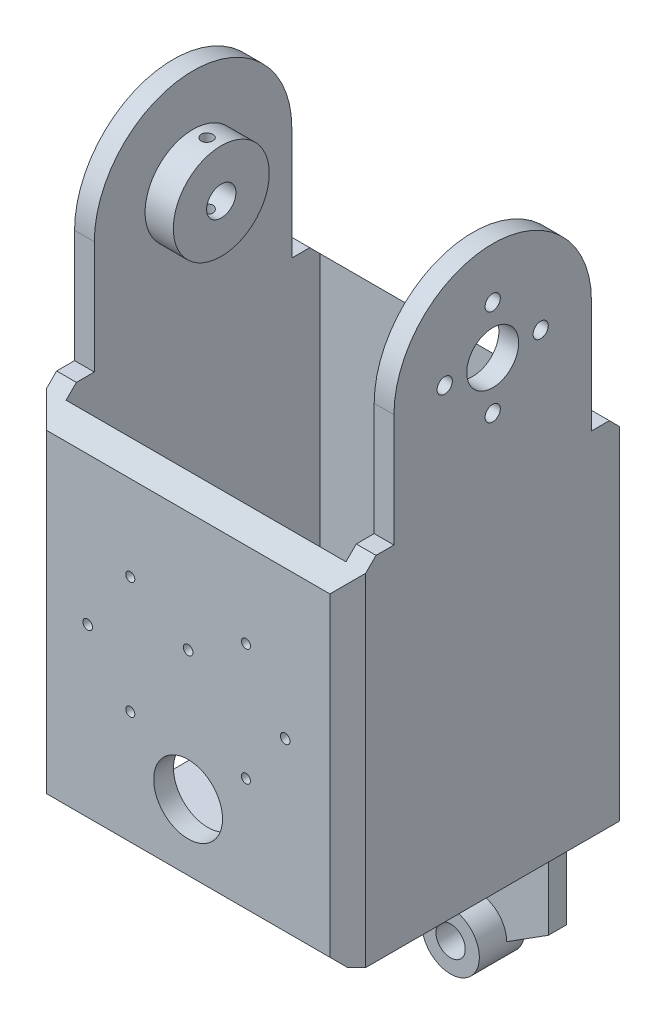
from build123d import *

# Parameters (mm, degrees)
SKETCH1_R                = 4.6
BOSS_EXTRUDE1_DEPTH      = 3.5
BOSS_EXTRUDE2_DEPTH      = 49.6
BOSS_EXTRUDE2_DEPTH_BACK = 3.5
CHAMFER2_SIZE            = 5
CUT_EXTRUDE1_REACH       = 110.911
SKETCH4_W                = 49.6
SKETCH4_H                = 45
BOSS_EXTRUDE3_START      = 3.5
SKETCH5_R                = 4.6
BOSS_EXTRUDE3_DEPTH      = 3.5
CHAMFER3_SIZE            = 3.175
SKETCH6_R                = 8.5
SKETCH6_R_2              = 2.6
BOSS_EXTRUDE4_DEPTH      = 5
SKETCH7_R                = 1.025
CUT_EXTRUDE2_DEPTH       = 114.246948082
CUT_EXTRUDE3_REACH       = 102.655
SKETCH9_R                = 1.35
SKETCH10_W               = 32
SKETCH10_H               = 36.825
SKETCH10_H_2             = 3.175
BOSS_EXTRUDE5_DEPTH      = 3.175
CHAMFER4_SIZE            = 1.5785
BOSS_EXTRUDE6_DEPTH      = 3.175
CHAMFER5_SIZE            = 1.5785
CUT_EXTRUDE4_REACH       = 112.625
SKETCH12_R               = 6.1
SKETCH12_R_2             = 0.800000003
SKETCH12_R_3             = 0.800000004
SKETCH12_R_4             = 0.8
SKETCH13_W               = 4.5
SKETCH13_H               = 25.745434895
SKETCH13_R               = 0.8
SKETCH13_R_2             = 0.800000003
SKETCH13_R_3             = 0.800000004
BOSS_EXTRUDE7_DEPTH      = 2.9
SKETCH14_W               = 15.732338892
SKETCH14_H               = 18.41
SKETCH14_R               = 6.1
BOSS_EXTRUDE8_DEPTH      = 0.325
SKETCH20_R               = 2.6
BOSS_EXTRUDE11_DEPTH     = 3.175
BOSS_EXTRUDE12_START     = 4.84
SKETCH21_R               = 5.1
SKETCH21_R_2             = 2.6
BOSS_EXTRUDE12_DEPTH     = 4.84
CHAMFER10_SIZE           = 3.175
CUT_EXTRUDE5_REACH       = 143.394
SKETCH23_R               = 0.85


with BuildPart() as part:
    # Sketch1 → Boss-Extrude1 (new body)
    with BuildSketch(Plane(origin=(0, 0, 0), x_dir=(0, 0, -1), z_dir=(1, 0, 0))):
        with BuildLine():
            Line((-17.5, 0), (-17.5, -20))
            Line((-17.5, -20), (-22.5, -20))
            Line((-22.5, -20), (-22.5, -76))
            Line((-22.5, -76), (22.5, -76))
            Line((22.5, -76), (22.5, -20))
            Line((22.5, -20), (17.5, -20))
            Line((17.5, -20), (17.5, 0))
            ThreePointArc((17.5, 0), (0, 17.5), (-17.5, 0))
        make_face()
        Circle(SKETCH1_R, mode=Mode.SUBTRACT)
    extrude(amount=-BOSS_EXTRUDE1_DEPTH)

    # Sketch2 → Boss-Extrude2 (add, two sides: drawn at the far end of the back side and taken through both)
    with BuildSketch(Plane(origin=(0, 0, 0), x_dir=(0, 0, -1), z_dir=(1, 0, 0)).offset(-BOSS_EXTRUDE2_DEPTH_BACK)):
        Polygon((-22.5, -20), (-22.5, -76), (22.5, -76), (22.5, -20), (25.675, -20), (25.675, -79.175), (-25.675, -79.175), (-25.675, -20), align=None)
    extrude(amount=BOSS_EXTRUDE2_DEPTH + BOSS_EXTRUDE2_DEPTH_BACK)

    # Chamfer2
    chamfer2_edges = [part.edges().sort_by_distance(p)[0] for p in [
        (23.05, -20, -25.675),
        (23.05, -20, 25.675),
    ]]
    chamfer(chamfer2_edges, length=CHAMFER2_SIZE)

    # Sketch4 → Cut-Extrude1 (cut, up to next)
    with BuildSketch(Plane(origin=(0, -76, 0), x_dir=(1, 0, 0), z_dir=(0, 1, 0)), mode=Mode.PRIVATE) as cut_extrude1_sk1:
        with Locations((24.8, 0)):
            Rectangle(SKETCH4_W, SKETCH4_H)
    cut_extrude1_tool1 = extrude(cut_extrude1_sk1.sketch, amount=-CUT_EXTRUDE1_REACH, mode=Mode.PRIVATE) & part.part
    add(cut_extrude1_tool1.solids().sort_by_distance((24.8, -76, 0))[0], mode=Mode.SUBTRACT)

    # Sketch5 → Boss-Extrude3 (add)
    with BuildSketch(Plane(origin=(49.6, 0, 0), x_dir=(0, 0, -1), z_dir=(1, 0, 0)).offset(BOSS_EXTRUDE3_START)):
        with BuildLine():
            Line((20.675, -20), (17.5, -20))
            Line((17.5, -20), (17.5, 0))
            ThreePointArc((17.5, 0), (0, 17.5), (-17.5, 0))
            Line((-17.5, 0), (-17.5, -20))
            Line((-17.5, -20), (-20.675, -20))
            Line((-20.675, -20), (-25.675, -25))
            Line((-25.675, -25), (-25.675, -79.175))
            Line((-25.675, -79.175), (25.675, -79.175))
            Line((25.675, -79.175), (25.675, -25))
            Line((25.675, -25), (20.675, -20))
        make_face()
        Circle(SKETCH5_R, mode=Mode.SUBTRACT)
    extrude(amount=-BOSS_EXTRUDE3_DEPTH)

    # Chamfer3
    chamfer3_edges = [part.edges().sort_by_distance(p)[0] for p in [
        (-3.5, -52.0875, -25.675),
        (-3.5, -52.0875, 25.675),
        (53.1, -52.0875, 25.675),
        (53.1, -52.0875, -25.675),
    ]]
    chamfer(chamfer3_edges, length=CHAMFER3_SIZE)

    # Sketch6 → Boss-Extrude4 (add)
    with BuildSketch(Plane(origin=(0, 0, 0), x_dir=(0, 0, -1), z_dir=(1, 0, 0))):
        Circle(SKETCH6_R)
        Circle(SKETCH6_R_2, mode=Mode.SUBTRACT)
    extrude(amount=BOSS_EXTRUDE4_DEPTH)

    # Sketch7 → Cut-Extrude2 (cut, through all)
    with BuildSketch(Plane.XZ.offset(79.175)):
        with Locations(Location((2.5, 0, 0), (0, 0, 270))):
            Circle(SKETCH7_R)
    extrude(amount=-CUT_EXTRUDE2_DEPTH, mode=Mode.SUBTRACT)

    # Sketch9 → Cut-Extrude3 (cut, up to next)
    with BuildSketch(Plane(origin=(53.1, 0, 0), x_dir=(0, 0, -1), z_dir=(1, 0, 0)), mode=Mode.PRIVATE) as cut_extrude3_sk1:
        with Locations((0, 8.5)):
            Circle(SKETCH9_R)
    cut_extrude3_tool1 = extrude(cut_extrude3_sk1.sketch, amount=-CUT_EXTRUDE3_REACH, mode=Mode.PRIVATE) & part.part
    # Sketch9 → Cut-Extrude3 (cut, up to next)
    with BuildSketch(Plane(origin=(53.1, 0, 0), x_dir=(0, 0, -1), z_dir=(1, 0, 0)), mode=Mode.PRIVATE) as cut_extrude3_sk2:
        with Locations((8.5, 0)):
            Circle(SKETCH9_R)
    cut_extrude3_tool2 = extrude(cut_extrude3_sk2.sketch, amount=-CUT_EXTRUDE3_REACH, mode=Mode.PRIVATE) & part.part
    # Sketch9 → Cut-Extrude3 (cut, up to next)
    with BuildSketch(Plane(origin=(53.1, 0, 0), x_dir=(0, 0, -1), z_dir=(1, 0, 0)), mode=Mode.PRIVATE) as cut_extrude3_sk3:
        with Locations((0, -8.5)):
            Circle(SKETCH9_R)
    cut_extrude3_tool3 = extrude(cut_extrude3_sk3.sketch, amount=-CUT_EXTRUDE3_REACH, mode=Mode.PRIVATE) & part.part
    # Sketch9 → Cut-Extrude3 (cut, up to next)
    with BuildSketch(Plane(origin=(53.1, 0, 0), x_dir=(0, 0, -1), z_dir=(1, 0, 0)), mode=Mode.PRIVATE) as cut_extrude3_sk4:
        with Locations((-8.5, 0)):
            Circle(SKETCH9_R)
    cut_extrude3_tool4 = extrude(cut_extrude3_sk4.sketch, amount=-CUT_EXTRUDE3_REACH, mode=Mode.PRIVATE) & part.part
    add(cut_extrude3_tool1.solids().sort_by_distance((53.1, 8.5, 0))[0], mode=Mode.SUBTRACT)
    add(cut_extrude3_tool2.solids().sort_by_distance((53.1, 0, -8.5))[0], mode=Mode.SUBTRACT)
    add(cut_extrude3_tool3.solids().sort_by_distance((53.1, -8.5, 0))[0], mode=Mode.SUBTRACT)
    add(cut_extrude3_tool4.solids().sort_by_distance((53.1, 0, 8.5))[0], mode=Mode.SUBTRACT)

    # Sketch10 → Boss-Extrude5 (add)
    with BuildSketch(Plane.XZ.offset(79.175)):
        with Locations((24.8, 4.0875)):
            Rectangle(SKETCH10_W, SKETCH10_H)
        with Locations((24.8, 24.0875)):
            Rectangle(SKETCH10_W, SKETCH10_H_2)
    extrude(amount=BOSS_EXTRUDE5_DEPTH)

    # Chamfer4
    chamfer4_edges = [part.edges().sort_by_distance(p)[0] for p in [
        (24.8, -82.35, 25.675),
    ]]
    chamfer(chamfer4_edges, length=CHAMFER4_SIZE)

    # Sketch11 → Boss-Extrude6 (add)
    with BuildSketch(Plane.XZ.offset(79.175)):
        Polygon((49.925, 25.675), (40.8, 25.675), (40.8, 22.5), (49.6, 22.5), (49.6, -22.5), (0, -22.5), (0, 22.5), (8.8, 22.5), (8.8, 25.675), (-0.325, 25.675), (-3.5, 22.5), (-3.5, -22.5), (-0.325, -25.675), (49.925, -25.675), (53.1, -22.5), (53.1, 22.5), align=None)
    extrude(amount=BOSS_EXTRUDE6_DEPTH)

    # Chamfer5
    chamfer5_edges = [part.edges().sort_by_distance(p)[0] for p in [
        (4.2375, -82.35, 25.675),
        (45.3625, -82.35, 25.675),
    ]]
    chamfer(chamfer5_edges, length=CHAMFER5_SIZE - 0.0001)  # a hair under: the kernel refuses the full size

    # Sketch12 → Cut-Extrude4 (cut, up to next)
    with BuildSketch(Plane.XY.offset(25.675), mode=Mode.PRIVATE) as cut_extrude4_sk1:
        with Locations((24.8, -69.065)):
            Circle(SKETCH12_R)
    cut_extrude4_tool1 = extrude(cut_extrude4_sk1.sketch, amount=-CUT_EXTRUDE4_REACH, mode=Mode.PRIVATE) & part.part
    # Sketch12 → Cut-Extrude4 (cut, up to next)
    with BuildSketch(Plane.XY.offset(25.675), mode=Mode.PRIVATE) as cut_extrude4_sk2:
        with Locations((14.549999995, -40.065)):
            Circle(SKETCH12_R_2)
    cut_extrude4_tool2 = extrude(cut_extrude4_sk2.sketch, amount=-CUT_EXTRUDE4_REACH, mode=Mode.PRIVATE) & part.part
    # Sketch12 → Cut-Extrude4 (cut, up to next)
    with BuildSketch(Plane.XY.offset(25.675), mode=Mode.PRIVATE) as cut_extrude4_sk3:
        with Locations((35.049999995, -40.065)):
            Circle(SKETCH12_R_2)
    cut_extrude4_tool3 = extrude(cut_extrude4_sk3.sketch, amount=-CUT_EXTRUDE4_REACH, mode=Mode.PRIVATE) & part.part
    # Sketch12 → Cut-Extrude4 (cut, up to next)
    with BuildSketch(Plane.XY.offset(25.675), mode=Mode.PRIVATE) as cut_extrude4_sk4:
        with Locations((35.049999995, -60.765)):
            Circle(SKETCH12_R_3)
    cut_extrude4_tool4 = extrude(cut_extrude4_sk4.sketch, amount=-CUT_EXTRUDE4_REACH, mode=Mode.PRIVATE) & part.part
    # Sketch12 → Cut-Extrude4 (cut, up to next)
    with BuildSketch(Plane.XY.offset(25.675), mode=Mode.PRIVATE) as cut_extrude4_sk5:
        with Locations((14.55, -60.765)):
            Circle(SKETCH12_R_4)
    cut_extrude4_tool5 = extrude(cut_extrude4_sk5.sketch, amount=-CUT_EXTRUDE4_REACH, mode=Mode.PRIVATE) & part.part
    add(cut_extrude4_tool1.solids().sort_by_distance((24.8, -69.065, 25.675))[0], mode=Mode.SUBTRACT)
    add(cut_extrude4_tool2.solids().sort_by_distance((14.55, -40.065, 25.675))[0], mode=Mode.SUBTRACT)
    add(cut_extrude4_tool3.solids().sort_by_distance((35.05, -40.065, 25.675))[0], mode=Mode.SUBTRACT)
    add(cut_extrude4_tool4.solids().sort_by_distance((35.05, -60.765, 25.675))[0], mode=Mode.SUBTRACT)
    add(cut_extrude4_tool5.solids().sort_by_distance((14.55, -60.765, 25.675))[0], mode=Mode.SUBTRACT)

    # Sketch13 → Boss-Extrude7 (add)
    # profile 1 of 2: a face of its own
    with BuildSketch(Plane(origin=(0, 0, 22.5), x_dir=(-1, 0, 0), z_dir=(0, 0, -1))):
        with Locations((-14.693710375, -50.904646349)):
            Rectangle(SKETCH13_W, SKETCH13_H)
        with Locations(Location((-14.55, -60.765, 0), (0, 0, 180))):
            Circle(SKETCH13_R, mode=Mode.SUBTRACT)
        with Locations(Location((-14.549999995, -40.065, 0), (0, 0, 180))):
            Circle(SKETCH13_R_2, mode=Mode.SUBTRACT)
    # profile 2 of 2: a face of its own
    with BuildSketch(Plane(origin=(0, 0, 22.5), x_dir=(-1, 0, 0), z_dir=(0, 0, -1))):
        with Locations((-34.929584807, -50.904646349)):
            Rectangle(SKETCH13_W, SKETCH13_H)
        with Locations(Location((-35.049999995, -40.065, 0), (0, 0, 180))):
            Circle(SKETCH13_R_2, mode=Mode.SUBTRACT)
        with Locations(Location((-35.049999995, -60.765, 0), (0, 0, 180))):
            Circle(SKETCH13_R_3, mode=Mode.SUBTRACT)
    extrude(amount=BOSS_EXTRUDE7_DEPTH)

    # Sketch14 → Boss-Extrude8 (add)
    with BuildSketch(Plane(origin=(0, 0, 22.5), x_dir=(-1, 0, 0), z_dir=(0, 0, -1))):
        with Locations((-24.813415361, -69.97)):
            Rectangle(SKETCH14_W, SKETCH14_H)
        with Locations(Location((-24.8, -69.065, 0), (0, 0, 180))):
            Circle(SKETCH14_R, mode=Mode.SUBTRACT)
    extrude(amount=BOSS_EXTRUDE8_DEPTH)

    # Sketch20 → Boss-Extrude11 (add)
    with BuildSketch(Plane(origin=(0, 0, -25.675), x_dir=(-1, 0, 0), z_dir=(0, 0, -1))):
        with BuildLine():
            Line((-37.3, -69.38), (-37.3, -109.38))
            Line((-37.3, -109.38), (-29.9, -114.0625))
            ThreePointArc((-29.9, -114.0625), (-24.8, -119.1625), (-19.7, -114.0625))
            Line((-19.7, -114.0625), (-12.3, -109.38))
            Line((-12.3, -109.38), (-12.3, -69.38))
            Line((-12.3, -69.38), (-37.3, -69.38))
        make_face()
        with Locations(Location((-24.8, -114.0625, 0), (0, 0, 90))):
            Circle(SKETCH20_R, mode=Mode.SUBTRACT)
    extrude(amount=BOSS_EXTRUDE11_DEPTH)

    # Sketch21 → Boss-Extrude12 (add)
    with BuildSketch(Plane.XY.offset(-25.675).offset(BOSS_EXTRUDE12_START)):
        with Locations((24.8, -114.0625)):
            Circle(SKETCH21_R)
        with Locations((24.8, -114.0625)):
            Circle(SKETCH21_R_2, mode=Mode.SUBTRACT)
    extrude(amount=-BOSS_EXTRUDE12_DEPTH)

    # Chamfer10
    chamfer10_edges = [part.edges().sort_by_distance(p)[0] for p in [
        (24.8, -69.38, -25.675),
    ]]
    chamfer(chamfer10_edges, length=CHAMFER10_SIZE - 0.0001)  # a hair under: the kernel refuses the full size

    # Sketch23 → Cut-Extrude5 (cut, up to next)
    with BuildSketch(Plane.XY.offset(25.675), mode=Mode.PRIVATE) as cut_extrude5_sk1:
        with Locations((7.001302854, -51.165)):
            Circle(SKETCH23_R)
    cut_extrude5_tool1 = extrude(cut_extrude5_sk1.sketch, amount=-CUT_EXTRUDE5_REACH, mode=Mode.PRIVATE) & part.part
    # Sketch23 → Cut-Extrude5 (cut, up to next)
    with BuildSketch(Plane.XY.offset(25.675), mode=Mode.PRIVATE) as cut_extrude5_sk2:
        with Locations((24.799997965, -46.165)):
            Circle(SKETCH23_R)
    cut_extrude5_tool2 = extrude(cut_extrude5_sk2.sketch, amount=-CUT_EXTRUDE5_REACH, mode=Mode.PRIVATE) & part.part
    # Sketch23 → Cut-Extrude5 (cut, up to next)
    with BuildSketch(Plane.XY.offset(25.675), mode=Mode.PRIVATE) as cut_extrude5_sk3:
        with Locations((42.001302854, -51.165)):
            Circle(SKETCH23_R)
    cut_extrude5_tool3 = extrude(cut_extrude5_sk3.sketch, amount=-CUT_EXTRUDE5_REACH, mode=Mode.PRIVATE) & part.part
    add(cut_extrude5_tool1.solids().sort_by_distance((7.001303, -51.165, 25.675))[0], mode=Mode.SUBTRACT)
    add(cut_extrude5_tool2.solids().sort_by_distance((24.799998, -46.165, 25.675))[0], mode=Mode.SUBTRACT)
    add(cut_extrude5_tool3.solids().sort_by_distance((42.001303, -51.165, 25.675))[0], mode=Mode.SUBTRACT)


solid = part.part
